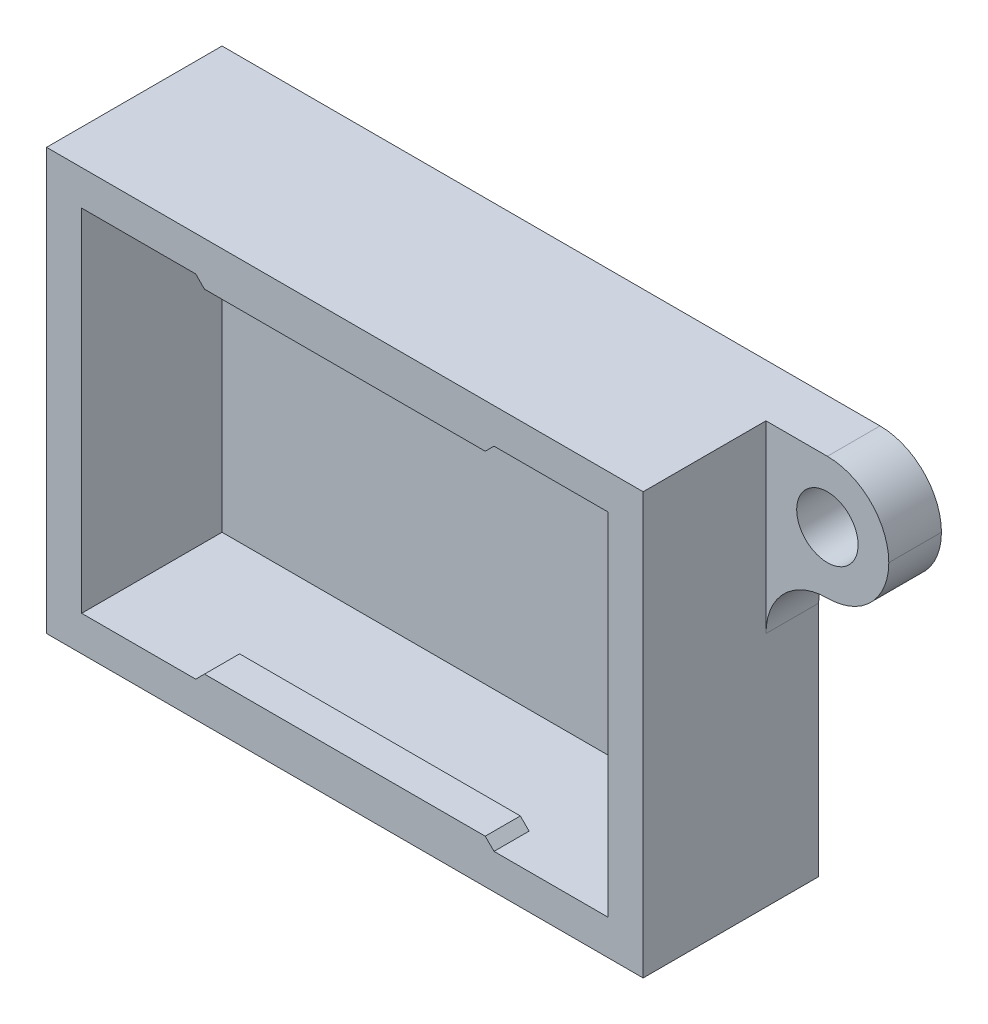
from build123d import *

# Parameters (mm, degrees)
SKETCH1_W                = 34
SKETCH1_H                = 24
BOSS_EXTRUDE1_DEPTH      = 10
SKETCH2_W                = 30
SKETCH2_H                = 20
CUT_EXTRUDE1_DEPTH       = 8
SKETCH3_W                = 16
SKETCH3_H                = 2
BOSS_EXTRUDE2_DEPTH      = 0.5
CHAMFER1_SIZE            = 0.5
SKETCH4_W                = 7
SKETCH4_H                = 7
BOSS_EXTRUDE3_DEPTH      = 3
FILLET1_R                = 3.5
SKETCH6_R                = 1.75
CUT_EXTRUDE2_DEPTH       = 29.635642127
CIRPATTERN2_COUNT        = 2
FILLET1_OF_CIRPATTERN2_R = 3.5
FILLET2_R                = 3.5


with BuildPart() as part:
    # Sketch1 → Boss-Extrude1 (new body)
    with BuildSketch(Plane.XY):
        Rectangle(SKETCH1_W, SKETCH1_H)
    extrude(amount=BOSS_EXTRUDE1_DEPTH)

    # Sketch2 → Cut-Extrude1 (cut)
    with BuildSketch(Plane.XY.offset(10)):
        Rectangle(SKETCH2_W, SKETCH2_H)
    extrude(amount=-CUT_EXTRUDE1_DEPTH, mode=Mode.SUBTRACT)

    # Sketch3 → Boss-Extrude2 (add)
    with BuildSketch(Plane.XZ.offset(-10)):
        with Locations((0, 9)):
            Rectangle(SKETCH3_W, SKETCH3_H)
    boss_extrude2 = extrude(amount=BOSS_EXTRUDE2_DEPTH)

    # Mirror1: Boss-Extrude2 across plane
    add(boss_extrude2.mirror(Plane.ZX))

    # Chamfer1
    chamfer1_edges = [part.edges().sort_by_distance(p)[0] for p in [
        (8, 10, 9),
        (-8, 10, 9),
        (-8, -10, 9),
        (8, -10, 9),
    ]]
    chamfer(chamfer1_edges, length=CHAMFER1_SIZE - 0.0001)  # a hair under: the kernel refuses the full size

    # Sketch4 → Boss-Extrude3 (add)
    with BuildSketch(Plane.XY):
        with Locations((20.5, 8.5)):
            Rectangle(SKETCH4_W, SKETCH4_H)
    boss_extrude3 = extrude(amount=BOSS_EXTRUDE3_DEPTH)

    # Fillet1
    fillet1_edges = [part.edges().sort_by_distance(p)[0] for p in [
        (24, 12, 1.5),
        (24, 5, 1.5),
    ]]
    fillet(fillet1_edges, radius=FILLET1_R - 0.0001)  # a hair under: the kernel refuses the full size

    # Sketch6 → Cut-Extrude2 (cut, through all)
    with BuildSketch(Plane(origin=(0, 0, 0), x_dir=(-1, 0, 0), z_dir=(0, 0, -1))):
        with Locations((-20.5, 8.5)):
            Circle(SKETCH6_R)
    cut_extrude2 = extrude(amount=-CUT_EXTRUDE2_DEPTH, mode=Mode.SUBTRACT)

    # CirPattern2: Boss-Extrude3, Cut-Extrude2 ×2 about axis
    cirpattern2_axis = Axis((0, 0, 0), (0, 0, 1))
    add([boss_extrude3.rotate(cirpattern2_axis, i * 360 / CIRPATTERN2_COUNT) for i in range(1, CIRPATTERN2_COUNT)])
    add([cut_extrude2.rotate(cirpattern2_axis, i * 360 / CIRPATTERN2_COUNT) for i in range(1, CIRPATTERN2_COUNT)], mode=Mode.SUBTRACT)

    # Fillet1 of CirPattern2
    fillet1_of_cirpattern2_edges = [part.edges().sort_by_distance(p)[0] for p in [
        (-24, -12, 1.5),
        (-24, -5, 1.5),
    ]]
    fillet(fillet1_of_cirpattern2_edges, radius=FILLET1_OF_CIRPATTERN2_R - 0.0001)  # a hair under: the kernel refuses the full size

    # Fillet2
    fillet2_edges = [part.edges().sort_by_distance(p)[0] for p in [
        (-17, -5, 1.5),
        (17, 5, 1.5),
    ]]
    fillet(fillet2_edges, radius=FILLET2_R)


solid = part.part
